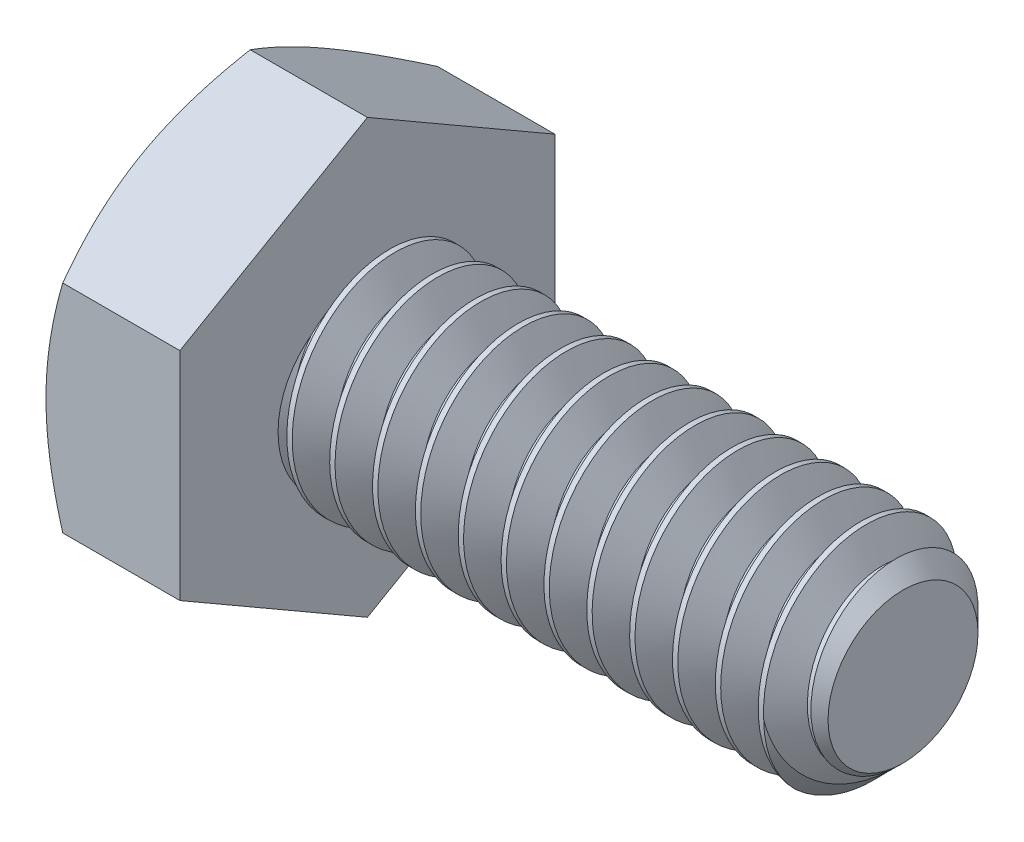
from build123d import *

# Parameters (mm, degrees)
SKETCH5_R           = 3.175
BOSS_EXTRUDE3_DEPTH = 15.875
CHAMFER1_SIZE       = 0.9525
BOSS_EXTRUDE4_DEPTH = 3.96875
SKETCH12_OUTSIDE_W  = 96.564
SKETCH12_OUTSIDE_H  = 98.284
SKETCH12_OUTSIDE_R  = 5.55625
CUT_EXTRUDE1_DEPTH  = 22.582605964
CUT_EXTRUDE1_DRAFT  = -60
CUT_SWEEP1_PITCH    = 1.27
BOSS_EXTRUDE5_DEPTH = 3.472485


with BuildPart() as part:
    # Sketch5 → Boss-Extrude3 (new body)
    with BuildSketch(Plane(origin=(9.921875, 0, 0), x_dir=(0, 0, -1), z_dir=(1, 0, 0))):
        Circle(SKETCH5_R)
    extrude(amount=-BOSS_EXTRUDE3_DEPTH)

    # Chamfer1
    chamfer1_edges = [part.edges().sort_by_distance(p)[0] for p in [
        (9.921875, 0, 3.175),
    ]]
    chamfer(chamfer1_edges, length=CHAMFER1_SIZE)

    # Sketch11 → Boss-Extrude4 (add)
    with BuildSketch(Plane.ZY.offset(5.953125)):
        Polygon((0, 6.415804866), (-5.55625, 3.207902433), (-5.55625, -3.207902433), (0, -6.415804866), (5.55625, -3.207902433), (5.55625, 3.207902433), align=None)
    extrude(amount=BOSS_EXTRUDE4_DEPTH)


with BuildPart() as cut_extrude1_tool:
    # Sketch12 outside → Cut-Extrude1 (with draft: the straight prism first)
    with BuildSketch(Plane.ZY.offset(9.921875)):
        Rectangle(SKETCH12_OUTSIDE_W, SKETCH12_OUTSIDE_H)
        Circle(SKETCH12_OUTSIDE_R, mode=Mode.SUBTRACT)
    extrude(amount=-CUT_EXTRUDE1_DEPTH)
    # Cut-Extrude1: the draft: its side faces are tilted about the plane it starts from
    cut_extrude1_sides = [cut_extrude1_tool.faces().sort_by_distance(p)[0] for p in [
        (1.369427982, -49.142, 0),
        (1.369427982, 0, 48.282),
        (1.369427982, 49.142, 0),
        (1.369427982, 0, -48.282),
        (1.369427982, 0, -5.55625),
    ]]
    draft(cut_extrude1_sides, Plane.ZY.offset(9.921875), CUT_EXTRUDE1_DRAFT)


with BuildPart() as part_1:
    add(part.part)

    # Cut-Extrude1: cut by cut_extrude1_tool
    add(cut_extrude1_tool.part, mode=Mode.SUBTRACT)

    # Cut-Sweep1: the profile of Sketch10 profile screwed along a right-hand helix of 13.5 turns, 8 arcs to a turn; built about Z, then put on its axis
    cut_sweep1_z = Axis((0, 0, 0), (0, 0, 1))
    cut_sweep1_corners = [(3.1753, 0, 0.000173205), (2.350110803, 0, -0.47625), (2.350110803, 0, -0.635), (3.1753, 0, -1.111423205)]
    with BuildLine(mode=Mode.PRIVATE) as cut_sweep1_profile:
        Line(cut_sweep1_corners[0], cut_sweep1_corners[1])
        Line(cut_sweep1_corners[1], cut_sweep1_corners[2])
        Line(cut_sweep1_corners[2], cut_sweep1_corners[3])
        Line(cut_sweep1_corners[3], cut_sweep1_corners[0])
    cut_sweep1_cap = Face(cut_sweep1_profile.wire())
    cut_sweep1_turn_angles = [0, 22.5, 45, 67.5, 90, 112.5, 135, 157.5, 180, 202.5, 225, 247.5, 270, 292.5, 315, 337.5, 360]
    cut_sweep1_turn_weights = [1, 0.9238795325112867, 1, 0.9238795325112867, 1, 0.9238795325112867, 1, 0.9238795325112867, 1, 0.9238795325112867, 1, 0.9238795325112867, 1, 0.9238795325112867, 1, 0.9238795325112867, 1]
    cut_sweep1_turn_rails = [Edge.make_bspline([Vector(p[0], p[1], 0).rotate(cut_sweep1_z, cut_sweep1_turn_angles[k]) / cut_sweep1_turn_weights[k] + Vector(0, 0, p[2] + CUT_SWEEP1_PITCH * cut_sweep1_turn_angles[k] / 360) for k in range(17)], [0, 0, 0, 1, 1, 2, 2, 3, 3, 4, 4, 5, 5, 6, 6, 7, 7, 8, 8, 8], 2, cut_sweep1_turn_weights) for p in cut_sweep1_corners]
    cut_sweep1_turn_sides = [Face.make_surface_from_curves(cut_sweep1_turn_rails[p[0]], cut_sweep1_turn_rails[p[1]]) for p in [(0, 1), (1, 2), (2, 3), (3, 0)]]
    cut_sweep1_last_angles = [4680, 4702.5, 4725, 4747.5, 4770, 4792.5, 4815, 4837.5, 4860]
    cut_sweep1_last_weights = [1, 0.9238795325112867, 1, 0.9238795325112867, 1, 0.9238795325112867, 1, 0.9238795325112351, 1]
    cut_sweep1_last_rails = [Edge.make_bspline([Vector(p[0], p[1], 0).rotate(cut_sweep1_z, cut_sweep1_last_angles[k]) / cut_sweep1_last_weights[k] + Vector(0, 0, p[2] + CUT_SWEEP1_PITCH * cut_sweep1_last_angles[k] / 360) for k in range(9)], [0, 0, 0, 1, 1, 2, 2, 3, 3, 4, 4, 4], 2, cut_sweep1_last_weights) for p in cut_sweep1_corners]
    cut_sweep1_last_sides = [Face.make_surface_from_curves(cut_sweep1_last_rails[p[0]], cut_sweep1_last_rails[p[1]]) for p in [(0, 1), (1, 2), (2, 3), (3, 0)]]
    cut_sweep1 = Plane(origin=(9.921875, 0, 0), x_dir=(0, 1, 0), z_dir=(-1, 0, 0)) * Solid(Shell([*[p.moved(Location((0, 0, CUT_SWEEP1_PITCH * i))) for i in range(13) for p in cut_sweep1_turn_sides], *cut_sweep1_last_sides, cut_sweep1_cap, cut_sweep1_cap.rotate(cut_sweep1_z, 4860).moved(Location((0, 0, CUT_SWEEP1_PITCH * 4860 / 360)))]))
    add(cut_sweep1, mode=Mode.SUBTRACT)

    # Sketch13 → Boss-Extrude5 (add)
    with BuildSketch(Plane(origin=(-5.953125, 0, 0), x_dir=(0, 0, -1), z_dir=(1, 0, 0))):
        Polygon((0, 6.415804866), (-5.55625, 3.207902433), (-5.55625, -3.207902433), (0, -6.415804866), (5.55625, -3.207902433), (5.55625, 3.207902433), align=None)
    extrude(amount=-BOSS_EXTRUDE5_DEPTH)


solid = part_1.part
